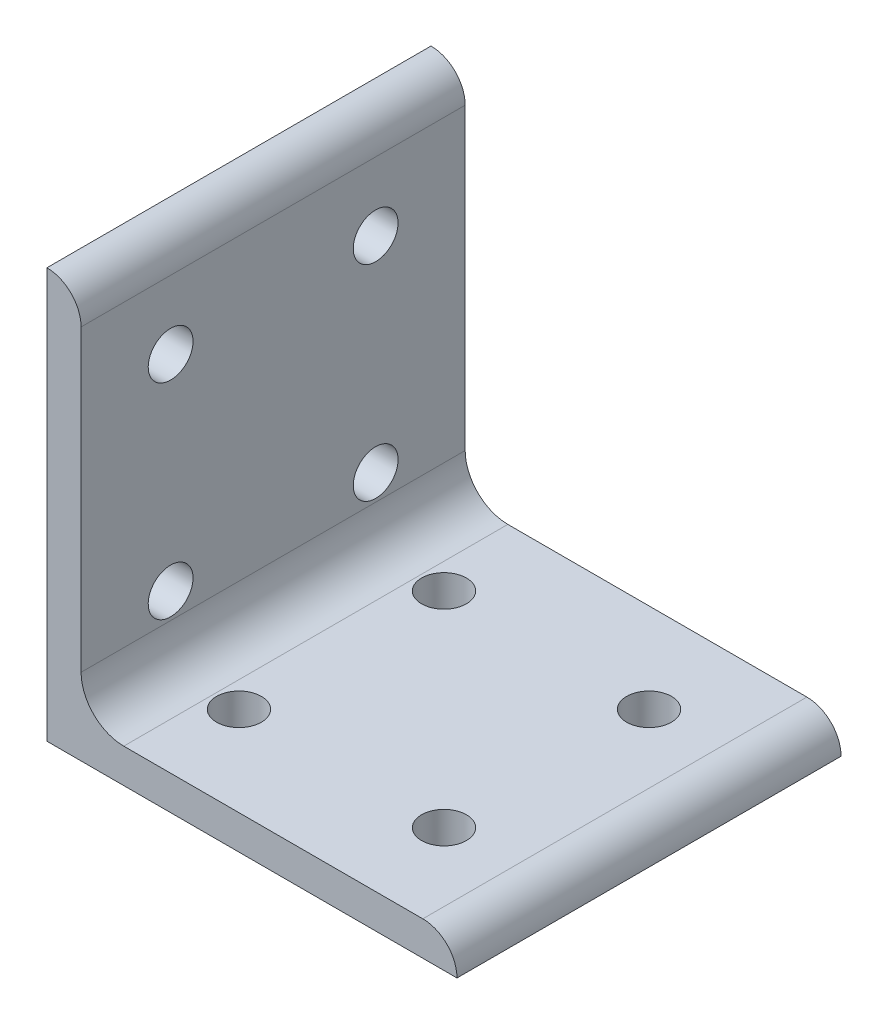
from build123d import *

# Parameters (mm, degrees)
BOSS_EXTRUDE1_DEPTH = 35.687
FILLET1_R           = 6.35
SKETCH3_R           = 4.1656
CUT_EXTRUDE1_DEPTH  = 114.518465322
CUT_EXTRUDE2_REACH  = 115.518
SKETCH4_R           = 4.1656


with BuildPart() as part:
    # Sketch2 → Boss-Extrude1 (new, symmetric)
    with BuildSketch(Plane.XY):
        with BuildLine():
            Line((0, 0), (0, 76.2))
            Line((0, 76.2), (6.35, 76.2))
            Line((6.35, 76.2), (6.35, 14.2748))
            ThreePointArc((6.35, 14.2748), (8.67112018, 8.67112018), (14.2748, 6.35))
            Line((14.2748, 6.35), (76.2, 6.35))
            Line((76.2, 6.35), (76.2, 0))
            Line((76.2, 0), (0, 0))
        make_face()
    extrude(amount=BOSS_EXTRUDE1_DEPTH, both=True)

    # Fillet1
    fillet1_edges = [part.edges().sort_by_distance(p)[0] for p in [
        (76.2, 6.35, 0),
        (6.35, 76.2, 0),
    ]]
    fillet(fillet1_edges, radius=FILLET1_R - 0.0001)  # a hair under: the kernel refuses the full size

    # Sketch3 → Cut-Extrude1 (cut, through all)
    with BuildSketch(Plane.ZY):
        with Locations(Location((-19.05, 57.15, 0), (0, 0, 270))):
            Circle(SKETCH3_R)
        with Locations(Location((-19.05, 19.05, 0), (0, 0, 270))):
            Circle(SKETCH3_R)
        with Locations(Location((19.05, 19.05, 0), (0, 0, 270))):
            Circle(SKETCH3_R)
        with Locations(Location((19.05, 57.15, 0), (0, 0, 270))):
            Circle(SKETCH3_R)
    extrude(amount=-CUT_EXTRUDE1_DEPTH, mode=Mode.SUBTRACT)

    # Sketch4 → Cut-Extrude2 (cut, up to next)
    with BuildSketch(Plane.XZ, mode=Mode.PRIVATE) as cut_extrude2_sk1:
        with Locations((57.15, 19.05)):
            Circle(SKETCH4_R)
    cut_extrude2_tool1 = extrude(cut_extrude2_sk1.sketch, amount=-CUT_EXTRUDE2_REACH, mode=Mode.PRIVATE) & part.part
    # Sketch4 → Cut-Extrude2 (cut, up to next)
    with BuildSketch(Plane.XZ, mode=Mode.PRIVATE) as cut_extrude2_sk2:
        with Locations(Location((19.05, -19.05, 0), (0, 0, 270))):
            Circle(SKETCH4_R)
    cut_extrude2_tool2 = extrude(cut_extrude2_sk2.sketch, amount=-CUT_EXTRUDE2_REACH, mode=Mode.PRIVATE) & part.part
    # Sketch4 → Cut-Extrude2 (cut, up to next)
    with BuildSketch(Plane.XZ, mode=Mode.PRIVATE) as cut_extrude2_sk3:
        with Locations(Location((57.15, -19.05, 0), (0, 0, 270))):
            Circle(SKETCH4_R)
    cut_extrude2_tool3 = extrude(cut_extrude2_sk3.sketch, amount=-CUT_EXTRUDE2_REACH, mode=Mode.PRIVATE) & part.part
    # Sketch4 → Cut-Extrude2 (cut, up to next)
    with BuildSketch(Plane.XZ, mode=Mode.PRIVATE) as cut_extrude2_sk4:
        with Locations((19.05, 19.05)):
            Circle(SKETCH4_R)
    cut_extrude2_tool4 = extrude(cut_extrude2_sk4.sketch, amount=-CUT_EXTRUDE2_REACH, mode=Mode.PRIVATE) & part.part
    add(cut_extrude2_tool1.solids().sort_by_distance((57.15, 0, 19.05))[0], mode=Mode.SUBTRACT)
    add(cut_extrude2_tool2.solids().sort_by_distance((19.05, 0, -19.05))[0], mode=Mode.SUBTRACT)
    add(cut_extrude2_tool3.solids().sort_by_distance((57.15, 0, -19.05))[0], mode=Mode.SUBTRACT)
    add(cut_extrude2_tool4.solids().sort_by_distance((19.05, 0, 19.05))[0], mode=Mode.SUBTRACT)


solid = part.part
